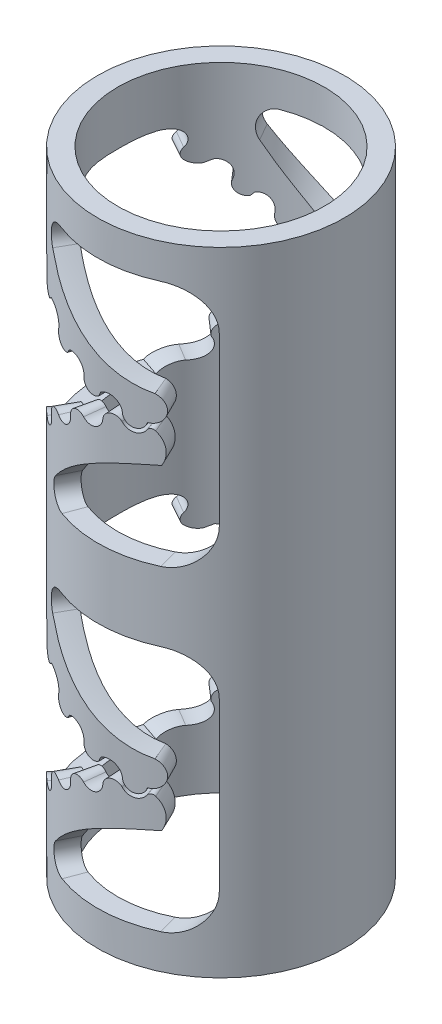
from build123d import *
from build123d.topology import SkipClean

# Parameters (mm, degrees)
SURFACE_EXTRUDE1_1_BACK    = 2.488
SURFACE_EXTRUDE1_1_DEPTH   = 2.488
SURFACE_TRIM1_TOOL_2_BACK  = 3.85
SURFACE_TRIM1_TOOL_2_DEPTH = 7.7
THICKEN1_T1                = 0.1014
CUT_EXTRUDE1_REACH         = 4.743
SKETCH13_W                 = 0.459866416
SKETCH13_H                 = 1.244
FILLET1_R                  = 0.2
FILLET2_R                  = 0.2
CUT_EXTRUDE3_START         = -2
CUT_EXTRUDE3_OUTLINE_W     = 1.244
CUT_EXTRUDE3_OUTLINE_H     = 0.447
CUT_EXTRUDE3_DEPTH         = 4
LPATTERN1_COUNT            = 2
LPATTERN1_PITCH            = 1.594


with BuildPart() as body_1:
    # Surface-Extrude1: a surface, the sketch's curves swept straight by 2.488 mm
    with BuildLine(Plane(origin=(0, 0, 0), x_dir=(1, 0, 0), z_dir=(0, 1, 0)).offset(-SURFACE_EXTRUDE1_1_BACK), mode=Mode.PRIVATE) as surface_extrude1_1_path:
        ThreePointArc((-0.622, 0), (0, -0.622), (0.622, 0))
    surface_extrude1_1 = Shell.extrude(surface_extrude1_1_path.wire(), (0 * SURFACE_EXTRUDE1_1_DEPTH, 1 * SURFACE_EXTRUDE1_1_DEPTH, 0 * SURFACE_EXTRUDE1_1_DEPTH))
    # Surface-Trim1 tool: a surface, the sketch's curves swept straight by 7.7 mm
    with BuildLine(Plane.XY.offset(-SURFACE_TRIM1_TOOL_2_BACK), mode=Mode.PRIVATE) as surface_trim1_tool_2_path:
        Line((-0.622, -0.717942698), (-0.622, -1.768231503))
        Line((-0.622, -1.768231503), (-0.589496255, -1.768489593))
        ThreePointArc((-0.589496255, -1.768489593), (-0.567418178, -1.741516851), (-0.533080737, -1.735524317))
        ThreePointArc((-0.533080737, -1.735524317), (-0.470461831, -1.709873447), (-0.467896216, -1.642253094))
        ThreePointArc((-0.467896216, -1.642253094), (-0.452666592, -1.593359416), (-0.402412295, -1.583508591))
        ThreePointArc((-0.402412295, -1.583508591), (-0.342114625, -1.573338263), (-0.319355437, -1.516582084))
        ThreePointArc((-0.319355437, -1.516582084), (-0.305120702, -1.460934254), (-0.247949072, -1.455392291))
        ThreePointArc((-0.247949072, -1.455392291), (-0.180401816, -1.451559109), (-0.155919415, -1.38848822))
        ThreePointArc((-0.155919415, -1.38848822), (-0.12559298, -1.347213107), (-0.074863722, -1.354274977))
        ThreePointArc((-0.074863722, -1.354274977), (-0.014550254, -1.3643266), (0.025476532, -1.318103165))
        ThreePointArc((0.025476532, -1.318103165), (0.057013752, -1.270136998), (0.112858189, -1.283431669))
        ThreePointArc((0.112858189, -1.283431669), (0.162620126, -1.311557866), (0.212446118, -1.283545301))
        ThreePointArc((0.212446118, -1.283545301), (0.226990367, -1.274083009), (0.243457683, -1.279550884))
        ThreePointArc((0.243457683, -1.279550884), (0.278580888, -1.348595259), (0.26385408, -1.424647127))
        ThreePointArc((0.26385408, -1.424647127), (-0.03441276, -1.536015366), (-0.276835705, -1.742406035))
        ThreePointArc((-0.276835705, -1.742406035), (-0.286997151, -1.822651995), (-0.218706451, -1.866))
        Line((-0.218706451, -1.866), (0.4354, -1.866))
        Line((0.4354, -1.866), (0.4354, -0.622))
        Line((0.4354, -0.622), (-0.22736157, -0.622))
        ThreePointArc((-0.22736157, -0.622), (-0.312342203, -0.672852623), (-0.30769568, -0.771777377))
        ThreePointArc((-0.30769568, -0.771777377), (-0.070497164, -1.003342122), (0.24079179, -1.117291911))
        ThreePointArc((0.24079179, -1.117291911), (0.282978818, -1.195962942), (0.213348531, -1.251824373))
        ThreePointArc((0.213348531, -1.251824373), (0.16328955, -1.291460345), (0.115093133, -1.249579356))
        Line((0.115093133, -1.249579356), (0.114200131, -1.241530718))
        ThreePointArc((0.114200131, -1.241530718), (0.076824884, -1.192184193), (0.015320914, -1.199202052))
        Line((0.015320914, -1.199202052), (0.005146612, -1.221724646))
        ThreePointArc((0.005146612, -1.221724646), (-0.048380161, -1.223713434), (-0.072991643, -1.176138801))
        ThreePointArc((-0.072991643, -1.176138801), (-0.100147723, -1.118944036), (-0.163327288, -1.114816519))
        Line((-0.163327288, -1.114816519), (-0.177504979, -1.135685277))
        ThreePointArc((-0.177504979, -1.135685277), (-0.230524118, -1.128896783), (-0.247113488, -1.078084328))
        ThreePointArc((-0.247113488, -1.078084328), (-0.264659156, -1.017398211), (-0.326171271, -1.00301367))
        Line((-0.326171271, -1.00301367), (-0.344072443, -1.0215182))
        ThreePointArc((-0.344072443, -1.0215182), (-0.395157312, -1.006171997), (-0.403325231, -0.953460946))
        ThreePointArc((-0.403325231, -0.953460946), (-0.407859643, -0.8951905), (-0.458579272, -0.866146997))
        Line((-0.458579272, -0.866146997), (-0.490259983, -0.882153717))
        ThreePointArc((-0.490259983, -0.882153717), (-0.538042054, -0.858699175), (-0.537610675, -0.805472717))
        ThreePointArc((-0.537610675, -0.805472717), (-0.545255743, -0.728397799), (-0.622, -0.717942698))
    surface_trim1_tool_2 = Shell.extrude(surface_trim1_tool_2_path.wire(), (0 * SURFACE_TRIM1_TOOL_2_DEPTH, 0 * SURFACE_TRIM1_TOOL_2_DEPTH, 1 * SURFACE_TRIM1_TOOL_2_DEPTH))
    # Surface-Trim1: the surface trimmed, the side behind the tool kept
    surface_trim1_3 = split(surface_extrude1_1.faces()[0], bisect_by=surface_trim1_tool_2, keep=Keep.BOTTOM).faces()[0]
    add(Solid.thicken(surface_trim1_3, THICKEN1_T1))

    # Sketch13 → Cut-Extrude1 (cut, up to next)
    with BuildSketch(Plane(origin=(0.295184518, 0, -0.079094453), x_dir=(-0.2588190451025143, 0, -0.9659258262890701), z_dir=(0.96592582628907, 0, -0.25881904510251424)), mode=Mode.PRIVATE) as cut_extrude1_sk1:
        with Locations((-0.311817812, -1.244)):
            Rectangle(SKETCH13_W, SKETCH13_H)
    cut_extrude1_tool1 = extrude(cut_extrude1_sk1.sketch, amount=-CUT_EXTRUDE1_REACH, mode=Mode.PRIVATE) & body_1.part
    add(cut_extrude1_tool1.solids().sort_by_distance((0.375889, -1.244, 0.222098))[0], mode=Mode.SUBTRACT)

    # Fillet1
    fillet1_edges = [body_1.edges().sort_by_distance(p)[0] for p in [
        (0.419834117, -0.622, 0.386104182),
    ]]
    fillet(fillet1_edges, radius=FILLET1_R)

    # Fillet2
    fillet2_edges = [body_1.edges().sort_by_distance(p)[0] for p in [
        (0.419834117, -1.866, 0.386104182),
    ]]
    fillet(fillet2_edges, radius=FILLET2_R)

    # Mirror6: body 1 across plane


with BuildPart() as body_1_1:
    with SkipClean():  # the faces are left unmerged after this step: merging them gives an invalid solid
        add(body_1.part)
        add(body_1.part.mirror(Plane.XY))

    # Cut-Extrude3: read off the stored shape, not the designer's step
    # Cut-Extrude3 outline → Cut-Extrude3 (cut)
    with SkipClean():  # the faces are left unmerged after this step: merging them gives an invalid solid
        with BuildSketch(Plane.XY.offset(CUT_EXTRUDE3_START)):
            with Locations((0, -2.2645)):
                Rectangle(CUT_EXTRUDE3_OUTLINE_W, CUT_EXTRUDE3_OUTLINE_H)
            with Locations((0, -0.2235)):
                Rectangle(CUT_EXTRUDE3_OUTLINE_W, CUT_EXTRUDE3_OUTLINE_H)
        extrude(amount=CUT_EXTRUDE3_DEPTH, mode=Mode.SUBTRACT)


with BuildPart() as lpattern1_1:
    # LPattern1: pattern copy
    add(body_1_1.part.moved(Location(Vector(0, -1, 0) * (1 * LPATTERN1_PITCH))))

    # Intersect1: read off the stored shape, not the designer's step
    # Intersect1: union body 1
    add(body_1_1.part)


solid = lpattern1_1.part
